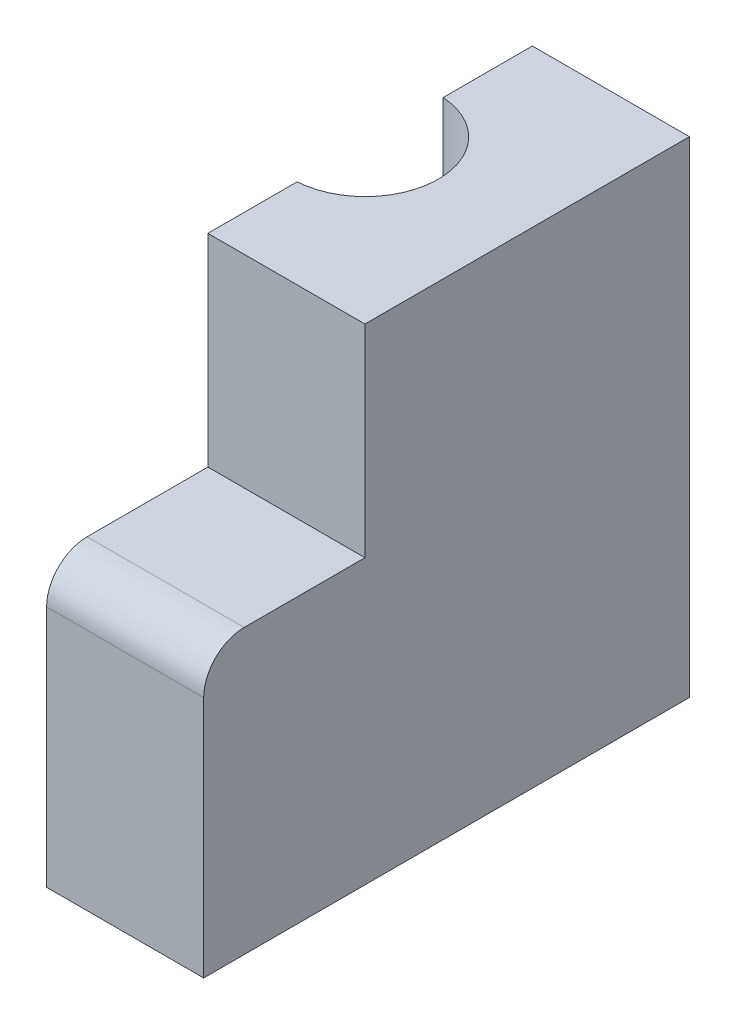
from build123d import *

# Parameters (mm, degrees)
BOSS_EXTRUDE1_DEPTH = 76.2
SKETCH2_R           = 15.24
CUT_EXTRUDE1_DEPTH  = 38.1
SKETCH3_R           = 17.78
CUT_EXTRUDE2_DEPTH  = 6.35
CUT_EXTRUDE3_DEPTH  = 12.7
CUT_EXTRUDE4_DEPTH  = 111.716033166
SKETCH6_W           = 76.2
SKETCH6_H           = 76.2
CUT_EXTRUDE5_DEPTH  = 0.762


with BuildPart() as part:
    # Sketch1 → Boss-Extrude1 (new body)
    with BuildSketch(Plane(origin=(0, 0, 0), x_dir=(1, 0, 0), z_dir=(0, 1, 0))):
        with BuildLine():
            Line((0, 0), (0, 39.2684))
            ThreePointArc((0, 39.2684), (11.4808, 50.7492), (0, 62.23))
            Line((0, 62.23), (0, 76.2))
            Line((0, 76.2), (25.4, 76.2))
            Line((25.4, 76.2), (25.4, 0))
            Line((25.4, 0), (0, 0))
        make_face()
    extrude(amount=BOSS_EXTRUDE1_DEPTH)

    # Sketch2 → Cut-Extrude1 (cut)
    with BuildSketch(Plane.XZ):
        with Locations((0, -50.7492)):
            Circle(SKETCH2_R)
    extrude(amount=-CUT_EXTRUDE1_DEPTH, mode=Mode.SUBTRACT)

    # Sketch3 → Cut-Extrude2 (cut)
    with BuildSketch(Plane(origin=(0, 16.51, 0), x_dir=(-1, 0, 0), z_dir=(0, -1, 0))):
        with Locations((0, 50.7492)):
            Circle(SKETCH3_R)
    extrude(amount=-CUT_EXTRUDE2_DEPTH, mode=Mode.SUBTRACT)

    # Sketch4 → Cut-Extrude3 (cut)
    with BuildSketch(Plane.ZY):
        with BuildLine():
            Line((-50.7492, 0), (-6.2992, 0))
            Line((-6.2992, 0), (-6.2992, 15.24))
            ThreePointArc((-6.2992, 15.24), (-12.994738982, 31.404461018), (-29.1592, 38.1))
            Line((-29.1592, 38.1), (-50.7492, 38.1))
            Line((-50.7492, 38.1), (-50.7492, 0))
        make_face()
    extrude(amount=-CUT_EXTRUDE3_DEPTH, mode=Mode.SUBTRACT)

    # Sketch5 → Cut-Extrude4 (cut, through all)
    with BuildSketch(Plane(origin=(25.4, 0, 0), x_dir=(0, 0, -1), z_dir=(1, 0, 0))):
        with BuildLine():
            Line((0, 76.2), (25.2984, 76.2))
            Line((25.2984, 76.2), (25.2984, 44.45))
            Line((25.2984, 44.45), (6.35, 44.45))
            ThreePointArc((6.35, 44.45), (1.859871939, 42.590128061), (0, 38.1))
            Line((0, 38.1), (0, 76.2))
        make_face()
    extrude(amount=-CUT_EXTRUDE4_DEPTH, mode=Mode.SUBTRACT)

    # Sketch6 → Cut-Extrude5 (cut)
    with BuildSketch(Plane.ZY):
        with Locations((-38.1, 38.1)):
            Rectangle(SKETCH6_W, SKETCH6_H)
    extrude(amount=-CUT_EXTRUDE5_DEPTH, mode=Mode.SUBTRACT)


solid = part.part
